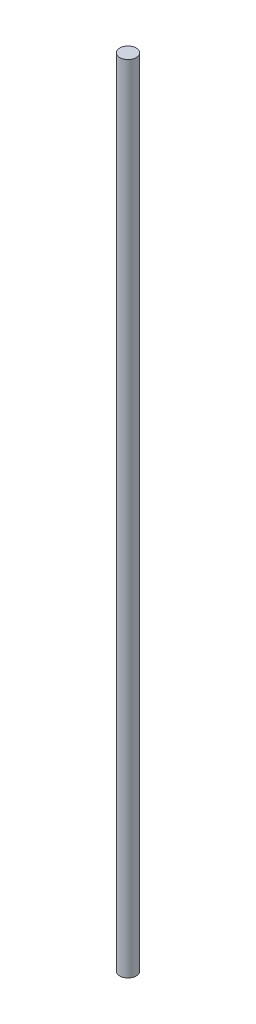
from build123d import *

# Parameters (mm, degrees)
SKETCH1_R           = 3.175
BOSS_EXTRUDE1_DEPTH = 304.8


with BuildPart() as part:
    # Sketch1 → Boss-Extrude1 (new body)
    with BuildSketch(Plane(origin=(0, 0, 0), x_dir=(1, 0, 0), z_dir=(0, 1, 0))):
        Circle(SKETCH1_R)
    extrude(amount=BOSS_EXTRUDE1_DEPTH)


solid = part.part
